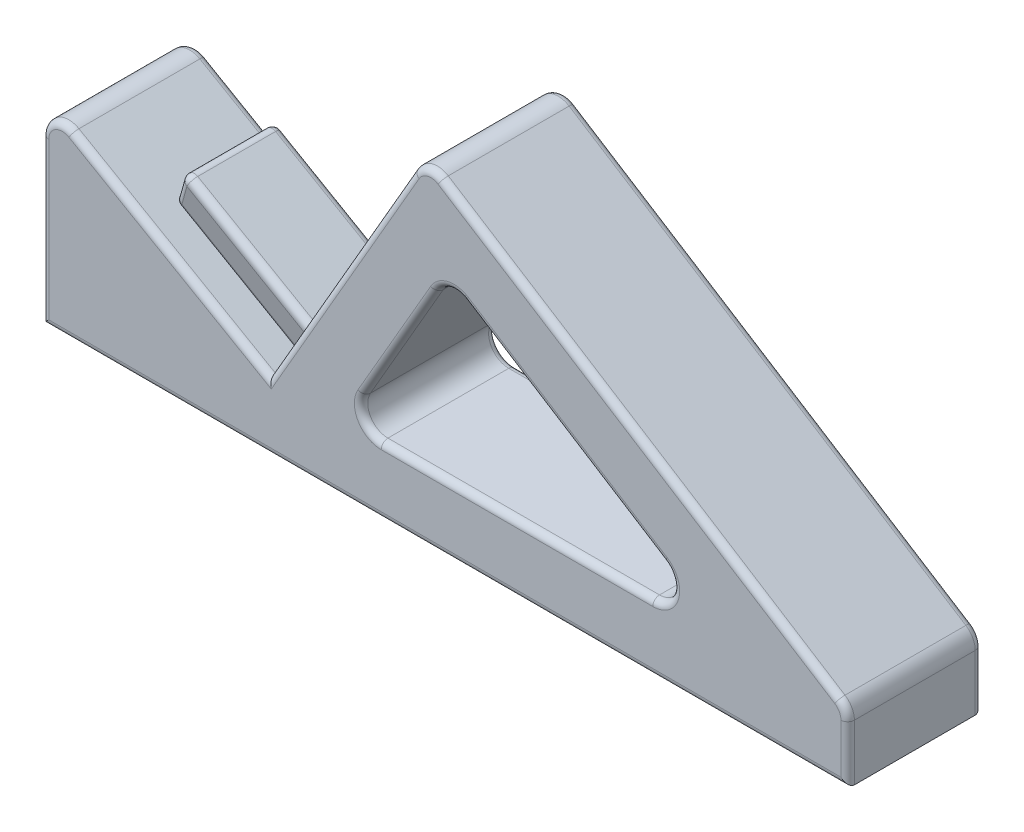
from build123d import *

# Parameters (mm, degrees)
RESSALTO_EXTRUS_O1_DEPTH = 20
RESSALTO_EXTRUS_O2_DEPTH = 22
CORTE_EXTRUS_O1_DEPTH    = 81.622577483
FILETE1_R                = 3
FILETE2_R                = 1
FILETE4_R                = 1


with BuildPart() as part:
    # Esboço1 → Ressalto-extrusão1 (new body)
    with BuildSketch(Plane.XY):
        Polygon((60, 0), (-60, 0), (-60, 29.5), (-26.225009252, 10), (-3.130998485, 50), (60, 10), align=None)
    extrude(amount=RESSALTO_EXTRUS_O1_DEPTH)

    # Esboço2 → Ressalto-extrusão2 (add)
    with BuildSketch(Plane(origin=(-23.998883958, 13.855762114, 0), x_dir=(0, 0, 1), z_dir=(-0.8660254037844418, 0.49999999999999484, 0))):
        Polygon((5.188348382, -4.384983309), (2.783800982, 2.347749412), (17.216199018, 2.347749412), (14.811651618, -4.384983309), (14.811651618, -4.452250588), (5.188348382, -4.452250588), align=None)
    extrude(amount=RESSALTO_EXTRUS_O2_DEPTH)

    # Esboço3 → Corte-extrusão1 (cut, through all)
    with BuildSketch(Plane.XY.offset(20)):
        Polygon((-14.678003869, 10), (41.315910897, 10), (0.319084351, 35.975718762), align=None)
    extrude(amount=-CORTE_EXTRUS_O1_DEPTH, mode=Mode.SUBTRACT)

    # Filete1
    filete1_edges = [part.edges().sort_by_distance(p)[0] for p in [
        (-60, 29.5, 10),
        (-3.130998485, 50, 10),
        (60, 10, 10),
        (-14.678003869, 10, 10),
        (0.319084351, 35.975718762, 10),
        (41.315910897, 10, 10),
    ]]
    fillet(filete1_edges, radius=FILETE1_R)

    # Filete2
    # the kernel refuses this fillet: 1 mm, written as the material it adds along each edge
    with BuildSketch(Plane(origin=(-25.870593694, 9.873051646, 5.188348382), x_dir=(-0.4999999999999947, -0.8660254037844417, -8.936278675324251e-11), z_dir=(-0.8660254037844417, 0.4999999999999947, 0))) as filete2_piece_1:
        with BuildLine():
            CenterArc((0.196805258, -0.991574461), FILETE2_R, 97.442894705, 12.210929358)
            Line((-0.139531139, -0.04983255), (0, 0))
            Line((0, 0), (0.067267279, 0))
        make_face()
    extrude(amount=22.370407054)
    with BuildSketch(Plane(origin=(-25.870593694, 9.873051646, 14.811651618), x_dir=(-0.4999999999999947, -0.8660254037844417, 8.941560163903726e-11), z_dir=(-0.8660254037844417, 0.4999999999999947, 0))) as filete2_piece_2:
        with BuildLine():
            CenterArc((0.196805258, 0.991574461), FILETE2_R, 250.346175937, 12.210929358)
            Line((-0.139531139, 0.04983255), (0, 0))
            Line((0, 0), (0.067267279, 0))
        make_face()
    extrude(amount=22.370407054)
    # the kernel refuses this fillet: 1 mm, written as the material it takes off along each edge
    with BuildSketch(Plane(origin=(-26.225009252, 10, 20), x_dir=(0.8660254037844417, -0.49999999999999484, 0), z_dir=(0.49999999999999484, 0.8660254037844417, 0))) as filete2_2_piece_1:
        with BuildLine():
            CenterArc((FILETE2_R, FILETE2_R), FILETE2_R, 180, 90)
            Line((0, FILETE2_R), (0, 0))
            Line((0, 0), (FILETE2_R, 0))
        make_face()
    extrude(amount=43.061918814, mode=Mode.SUBTRACT)
    with BuildSketch(Plane(origin=(-2.095973634, 45.792715629, 20), x_dir=(0.5352147458149246, 0.8447160326774114, 0), z_dir=(0.8447160326774114, -0.5352147458149246, 0))) as filete2_2_piece_2:
        with BuildLine():
            CenterArc((3 - FILETE2_R, -FILETE2_R), FILETE2_R, 0, 90)
            Line((3, -FILETE2_R), (3, 0))
            Line((3, 0), (3 - FILETE2_R, 0))
        make_face()
    revolve(axis=Axis((-2.095973634, 45.792715629, 20), (0, 0, 1)), revolution_arc=92.358476116, mode=Mode.SUBTRACT)
    with BuildSketch(Plane(origin=(-0.490329397, 48.326863727, 20), x_dir=(-0.5352147458149248, -0.8447160326774114, 0), z_dir=(0.8447160326774115, -0.5352147458149248, 0))) as filete2_2_piece_3:
        with BuildLine():
            CenterArc((FILETE2_R, FILETE2_R), FILETE2_R, 180, 90)
            Line((0, FILETE2_R), (0, 0))
            Line((0, 0), (FILETE2_R, 0))
        make_face()
    extrude(amount=69.959573807, mode=Mode.SUBTRACT)
    with BuildSketch(Plane(origin=(57, 8.349320116, 20), x_dir=(1, 0, 0), z_dir=(0, -1, 0))) as filete2_2_piece_4:
        with BuildLine():
            CenterArc((3 - FILETE2_R, -FILETE2_R), FILETE2_R, 0, 90)
            Line((3 - FILETE2_R, 0), (3, 0))
            Line((3, 0), (3, -FILETE2_R))
        make_face()
    revolve(axis=Axis((57, 8.349320116, 20), (0, 0, 1)), revolution_arc=57.641523884, mode=Mode.SUBTRACT)
    with BuildSketch(Plane(origin=(60, 8.349320116, 20), x_dir=(0, 0, -1), z_dir=(0, -1, 0))) as filete2_2_piece_5:
        with BuildLine():
            CenterArc((FILETE2_R, -FILETE2_R), FILETE2_R, 90, 90)
            Line((0, -FILETE2_R), (0, 0))
            Line((0, 0), (FILETE2_R, 0))
        make_face()
    extrude(amount=10.849320116, mode=Mode.SUBTRACT)
    with BuildSketch(Plane(origin=(62.5, 0, 20), x_dir=(0, 0, -1), z_dir=(-1, 0, 0)), Plane(origin=(62.5, 0, 0), x_dir=(0, 1, 0), z_dir=(-1, 0, 0))) as filete2_2_piece_6:
        with BuildLine():
            CenterArc((FILETE2_R, -FILETE2_R), FILETE2_R, 90, 90)
            Line((0, -FILETE2_R), (0, 0))
            Line((0, 0), (FILETE2_R, 0))
        make_face()
    extrude(amount=125, mode=Mode.SUBTRACT)
    with BuildSketch(Plane(origin=(-60, -2.5, 20), x_dir=(1, 0, 0), z_dir=(0, 1, 0))) as filete2_2_piece_7:
        with BuildLine():
            CenterArc((FILETE2_R, FILETE2_R), FILETE2_R, 180, 90)
            Line((0, FILETE2_R), (0, 0))
            Line((0, 0), (FILETE2_R, 0))
        make_face()
    extrude(amount=26.803847577, mode=Mode.SUBTRACT)
    with BuildSketch(Plane(origin=(-57, 24.303847577, 20), x_dir=(-1, 0, 0), z_dir=(0, -1, 0))) as filete2_2_piece_8:
        with BuildLine():
            CenterArc((3 - FILETE2_R, FILETE2_R), FILETE2_R, 270, 90)
            Line((3, FILETE2_R), (3, 0))
            Line((3, 0), (3 - FILETE2_R, 0))
        make_face()
    revolve(axis=Axis((-57, 24.303847577, 20), (0, 0, -1)), revolution_arc=120, mode=Mode.SUBTRACT)
    with BuildSketch(Plane(origin=(-55.5, 26.901923789, 20), x_dir=(-0.499999999999995, -0.8660254037844416, 0), z_dir=(0.8660254037844416, -0.499999999999995, 0))) as filete2_2_piece_9:
        with BuildLine():
            CenterArc((FILETE2_R, FILETE2_R), FILETE2_R, 180, 90)
            Line((0, FILETE2_R), (0, 0))
            Line((0, 0), (FILETE2_R, 0))
        make_face()
    extrude(amount=33.803847577, mode=Mode.SUBTRACT)
    with BuildSketch(Plane(origin=(-9.481851446, 13, 20), x_dir=(0, -1, 0), z_dir=(1, 0, 0))) as filete2_2_piece_10:
        with BuildLine():
            CenterArc((3 + FILETE2_R, FILETE2_R), FILETE2_R, 180, 90)
            Line((3, FILETE2_R), (3, 0))
            Line((3, 0), (3 + FILETE2_R, 0))
        make_face()
    revolve(axis=Axis((-9.481851446, 13, 20), (0, 0, -1)), revolution_arc=120, mode=Mode.SUBTRACT)
    with BuildSketch(Plane(origin=(-9.481851446, 10, 20), x_dir=(0, -1, 0), z_dir=(1, 0, 0)), Plane(origin=(30.97585928, 10, 0), x_dir=(0, -1, 0), z_dir=(-1, 0, 0))) as filete2_2_piece_11:
        with BuildLine():
            CenterArc((FILETE2_R, FILETE2_R), FILETE2_R, 180, 90)
            Line((0, FILETE2_R), (0, 0))
            Line((0, 0), (FILETE2_R, 0))
        make_face()
    extrude(amount=40.457710726, mode=Mode.SUBTRACT)
    with BuildSketch(Plane(origin=(30.97585928, 13, 20), x_dir=(0, -1, 0), z_dir=(-1, 0, 0))) as filete2_2_piece_12:
        with BuildLine():
            CenterArc((3 + FILETE2_R, -FILETE2_R), FILETE2_R, 90, 90)
            Line((3, -FILETE2_R), (3, 0))
            Line((3, 0), (3 + FILETE2_R, 0))
        make_face()
    revolve(axis=Axis((30.97585928, 13, 20), (0, 0, 1)), revolution_arc=147.641523884, mode=Mode.SUBTRACT)
    with BuildSketch(Plane(origin=(32.581503517, 15.534148098, 20), x_dir=(0.5352147458149246, 0.8447160326774116, 0), z_dir=(-0.8447160326774116, 0.5352147458149246, 0)), Plane(origin=(2.95975344, 34.302582489, 0), x_dir=(0.5352147458149246, 0.8447160326774116, 1.7763568394002497e-15), z_dir=(0.8447160326774116, -0.5352147458149246, 0))) as filete2_2_piece_13:
        with BuildLine():
            CenterArc((FILETE2_R, FILETE2_R), FILETE2_R, 180, 90)
            Line((0, FILETE2_R), (0, 0))
            Line((0, 0), (FILETE2_R, 0))
        make_face()
    extrude(amount=35.067110049, mode=Mode.SUBTRACT)
    with BuildSketch(Plane(origin=(1.354109202, 31.768434391, 20), x_dir=(-0.8660254037844415, 0.49999999999999517, 0), z_dir=(-0.49999999999999517, -0.8660254037844415, 0))) as filete2_2_piece_14:
        with BuildLine():
            CenterArc((3 + FILETE2_R, FILETE2_R), FILETE2_R, 180, 90)
            Line((3, FILETE2_R), (3, 0))
            Line((3, 0), (3 + FILETE2_R, 0))
        make_face()
    revolve(axis=Axis((1.354109202, 31.768434391, 20), (0, 0, -1)), revolution_arc=92.358476116, mode=Mode.SUBTRACT)
    with BuildSketch(Plane(origin=(-1.243967009, 33.268434391, 20), x_dir=(-0.8660254037844417, 0.4999999999999949, 0), z_dir=(-0.4999999999999949, -0.8660254037844417, 0)), Plane(origin=(-12.079927657, 14.5, 0), x_dir=(-0.8660254037844417, 0.4999999999999949, 0), z_dir=(0.4999999999999949, 0.8660254037844417, 0))) as filete2_2_piece_15:
        with BuildLine():
            CenterArc((FILETE2_R, FILETE2_R), FILETE2_R, 180, 90)
            Line((0, FILETE2_R), (0, 0))
            Line((0, 0), (FILETE2_R, 0))
        make_face()
    extrude(amount=21.671921296, mode=Mode.SUBTRACT)
    with BuildSketch(Plane(origin=(60, 8.349320116, 0), x_dir=(0, 0, 1), z_dir=(0, -1, 0))) as filete2_2_piece_16:
        with BuildLine():
            CenterArc((FILETE2_R, FILETE2_R), FILETE2_R, 180, 90)
            Line((0, FILETE2_R), (0, 0))
            Line((0, 0), (FILETE2_R, 0))
        make_face()
    extrude(amount=10.849320116, mode=Mode.SUBTRACT)
    with BuildSketch(Plane(origin=(57, 8.349320116, 0), x_dir=(1, 0, 0), z_dir=(0, -1, 0))) as filete2_2_piece_17:
        with BuildLine():
            CenterArc((3 - FILETE2_R, FILETE2_R), FILETE2_R, 270, 90)
            Line((3, FILETE2_R), (3, 0))
            Line((3, 0), (3 - FILETE2_R, 0))
        make_face()
    revolve(axis=Axis((57, 8.349320116, 0), (0, 0, 1)), revolution_arc=57.641523884, mode=Mode.SUBTRACT)
    with BuildSketch(Plane(origin=(-0.490329397, 48.326863727, 0), x_dir=(-0.5352147458149248, -0.8447160326774114, 0), z_dir=(0.8447160326774115, -0.5352147458149248, 0))) as filete2_2_piece_18:
        with BuildLine():
            CenterArc((FILETE2_R, -FILETE2_R), FILETE2_R, 90, 90)
            Line((0, -FILETE2_R), (0, 0))
            Line((0, 0), (FILETE2_R, 0))
        make_face()
    extrude(amount=69.959573807, mode=Mode.SUBTRACT)
    with BuildSketch(Plane(origin=(-2.095973634, 45.792715629, 0), x_dir=(0.5352147458149246, 0.8447160326774114, 0), z_dir=(0.8447160326774114, -0.5352147458149246, 0))) as filete2_2_piece_19:
        with BuildLine():
            CenterArc((3 - FILETE2_R, FILETE2_R), FILETE2_R, 270, 90)
            Line((3, FILETE2_R), (3, 0))
            Line((3, 0), (3 - FILETE2_R, 0))
        make_face()
    revolve(axis=Axis((-2.095973634, 45.792715629, 0), (0, 0, 1)), revolution_arc=92.358476116, mode=Mode.SUBTRACT)
    with BuildSketch(Plane(origin=(-26.225009252, 10, 0), x_dir=(0.8660254037844417, -0.49999999999999484, 0), z_dir=(0.49999999999999484, 0.8660254037844417, 0))) as filete2_2_piece_20:
        with BuildLine():
            CenterArc((FILETE2_R, -FILETE2_R), FILETE2_R, 90, 90)
            Line((0, -FILETE2_R), (0, 0))
            Line((0, 0), (FILETE2_R, 0))
        make_face()
    extrude(amount=43.061918814, mode=Mode.SUBTRACT)
    with BuildSketch(Plane(origin=(-55.5, 26.901923789, 0), x_dir=(-0.499999999999995, -0.8660254037844416, 0), z_dir=(0.8660254037844416, -0.499999999999995, 0))) as filete2_2_piece_21:
        with BuildLine():
            CenterArc((FILETE2_R, -FILETE2_R), FILETE2_R, 90, 90)
            Line((0, -FILETE2_R), (0, 0))
            Line((0, 0), (FILETE2_R, 0))
        make_face()
    extrude(amount=33.803847577, mode=Mode.SUBTRACT)
    with BuildSketch(Plane(origin=(-57, 24.303847577, 0), x_dir=(-1, 0, 0), z_dir=(0, -1, 0))) as filete2_2_piece_22:
        with BuildLine():
            CenterArc((3 - FILETE2_R, -FILETE2_R), FILETE2_R, 0, 90)
            Line((3, -FILETE2_R), (3, 0))
            Line((3, 0), (3 - FILETE2_R, 0))
        make_face()
    revolve(axis=Axis((-57, 24.303847577, 0), (0, 0, -1)), revolution_arc=120, mode=Mode.SUBTRACT)
    with BuildSketch(Plane(origin=(-60, -2.5, 0), x_dir=(1, 0, 0), z_dir=(0, 1, 0))) as filete2_2_piece_23:
        with BuildLine():
            CenterArc((FILETE2_R, -FILETE2_R), FILETE2_R, 90, 90)
            Line((0, -FILETE2_R), (0, 0))
            Line((0, 0), (FILETE2_R, 0))
        make_face()
    extrude(amount=26.803847577, mode=Mode.SUBTRACT)
    with BuildSketch(Plane(origin=(-9.481851446, 13, 0), x_dir=(0, -1, 0), z_dir=(1, 0, 0))) as filete2_2_piece_24:
        with BuildLine():
            CenterArc((3 + FILETE2_R, -FILETE2_R), FILETE2_R, 90, 90)
            Line((3, -FILETE2_R), (3, 0))
            Line((3, 0), (3 + FILETE2_R, 0))
        make_face()
    revolve(axis=Axis((-9.481851446, 13, 0), (0, 0, -1)), revolution_arc=120, mode=Mode.SUBTRACT)
    with BuildSketch(Plane(origin=(1.354109202, 31.768434391, 0), x_dir=(-0.8660254037844415, 0.49999999999999517, 0), z_dir=(-0.49999999999999517, -0.8660254037844415, 0))) as filete2_2_piece_25:
        with BuildLine():
            CenterArc((3 + FILETE2_R, -FILETE2_R), FILETE2_R, 90, 90)
            Line((3, -FILETE2_R), (3, 0))
            Line((3, 0), (3 + FILETE2_R, 0))
        make_face()
    revolve(axis=Axis((1.354109202, 31.768434391, 0), (0, 0, -1)), revolution_arc=92.358476116, mode=Mode.SUBTRACT)
    with BuildSketch(Plane(origin=(30.97585928, 13, 0), x_dir=(0, -1, 0), z_dir=(-1, 0, 0))) as filete2_2_piece_26:
        with BuildLine():
            CenterArc((3 + FILETE2_R, FILETE2_R), FILETE2_R, 180, 90)
            Line((3, FILETE2_R), (3, 0))
            Line((3, 0), (3 + FILETE2_R, 0))
        make_face()
    revolve(axis=Axis((30.97585928, 13, 0), (0, 0, 1)), revolution_arc=147.641523884, mode=Mode.SUBTRACT)
    with BuildSketch(Plane(origin=(-22.825009252, 15.888972746, 2.783800982), x_dir=(0, 0, 1), z_dir=(-0.8660254037844417, 0.4999999999999947, 0)), Plane(origin=(-22.825009252, 15.888972746, 17.216199018), x_dir=(-0.4708709557974139, -0.8155724192496512, -0.33633639699815604), z_dir=(-0.8660254037844417, 0.4999999999999947, 0))) as filete2_2_piece_27:
        with BuildLine():
            CenterArc((FILETE2_R * 1.41900491052, -FILETE2_R), FILETE2_R, 90, 109.653824058)
            Line((FILETE2_R * 0.477262998928, -FILETE2_R * 1.336336397), (0, 0))
            Line((0, 0), (FILETE2_R * 1.41900491052, 0))
        make_face()
    extrude(amount=25.547512276, mode=Mode.SUBTRACT)
    with BuildSketch(Plane(origin=(-27.475009252, 7.834936491, 20), x_dir=(0.8660254037844417, -0.4999999999999948, 0), z_dir=(0.49999999999999484, 0.8660254037844417, 0))) as filete2_2_piece_28a_section:
        with BuildLine():
            CenterArc((FILETE2_R, FILETE2_R), FILETE2_R, 180, 90)
            Line((0, FILETE2_R), (0, 0))
            Line((0, 0), (FILETE2_R, 0))
        make_face()
    filete2_2_piece_28a = extrude(amount=45.561918814, mode=Mode.PRIVATE)
    filete2_2_piece_28a = split(filete2_2_piece_28a, bisect_by=Plane(origin=(-26.225009252, 10, 20), z_dir=(-0.499999999999995, -0.8660254037844416, 0)), keep=Keep.TOP, mode=Mode.PRIVATE)
    with BuildSketch(Plane(origin=(-55.5, 26.901923789, 20), x_dir=(-0.499999999999995, -0.8660254037844416, 0), z_dir=(0.8660254037844416, -0.499999999999995, 0))) as filete2_2_piece_28b_section:
        with BuildLine():
            CenterArc((FILETE2_R, FILETE2_R), FILETE2_R, 180, 90)
            Line((0, FILETE2_R), (0, 0))
            Line((0, 0), (FILETE2_R, 0))
        make_face()
    filete2_2_piece_28b = extrude(amount=36.303847577, mode=Mode.PRIVATE)
    filete2_2_piece_28b = split(filete2_2_piece_28b, bisect_by=Plane(origin=(-26.225009252, 10, 20), z_dir=(0.8660254037844417, -0.49999999999999484, 0)), keep=Keep.TOP, mode=Mode.PRIVATE)
    filete2_2_piece_28 = filete2_2_piece_28a & filete2_2_piece_28b
    add(filete2_2_piece_28, mode=Mode.SUBTRACT)
    with BuildSketch(Plane(origin=(-27.475009252, 7.834936491, 0), x_dir=(0.8660254037844417, -0.4999999999999948, 0), z_dir=(0.49999999999999484, 0.8660254037844417, 0))) as filete2_2_piece_29a_section:
        with BuildLine():
            CenterArc((FILETE2_R, -FILETE2_R), FILETE2_R, 90, 90)
            Line((0, -FILETE2_R), (0, 0))
            Line((0, 0), (FILETE2_R, 0))
        make_face()
    filete2_2_piece_29a = extrude(amount=45.561918814, mode=Mode.PRIVATE)
    filete2_2_piece_29a = split(filete2_2_piece_29a, bisect_by=Plane(origin=(-26.225009252, 10, 0), z_dir=(-0.499999999999995, -0.8660254037844416, 0)), keep=Keep.TOP, mode=Mode.PRIVATE)
    with BuildSketch(Plane(origin=(-55.5, 26.901923789, 0), x_dir=(-0.499999999999995, -0.8660254037844416, 0), z_dir=(0.8660254037844416, -0.499999999999995, 0))) as filete2_2_piece_29b_section:
        with BuildLine():
            CenterArc((FILETE2_R, -FILETE2_R), FILETE2_R, 90, 90)
            Line((0, -FILETE2_R), (0, 0))
            Line((0, 0), (FILETE2_R, 0))
        make_face()
    filete2_2_piece_29b = extrude(amount=36.303847577, mode=Mode.PRIVATE)
    filete2_2_piece_29b = split(filete2_2_piece_29b, bisect_by=Plane(origin=(-26.225009252, 10, 0), z_dir=(0.8660254037844417, -0.49999999999999484, 0)), keep=Keep.TOP, mode=Mode.PRIVATE)
    filete2_2_piece_29 = filete2_2_piece_29a & filete2_2_piece_29b
    add(filete2_2_piece_29, mode=Mode.SUBTRACT)

    # Filete4
    filete4_edges = [part.edges().sort_by_distance(p)[0] for p in [
        (-43.85995263, 23.455382081, 4.199789907),
        (-43.85995263, 23.455382081, 15.800210093),
        (-41.877568136, 26.888972746, 10),
        (-42.089543917, 26.521819922, 16.614609668),
        (-42.089543917, 26.521819922, 3.385390332),
        (-45.22520413, 21.090697119, 5.16894646),
        (-45.22520413, 21.090697119, 14.83105354),
    ]]
    fillet(filete4_edges, radius=FILETE4_R)


solid = part.part
